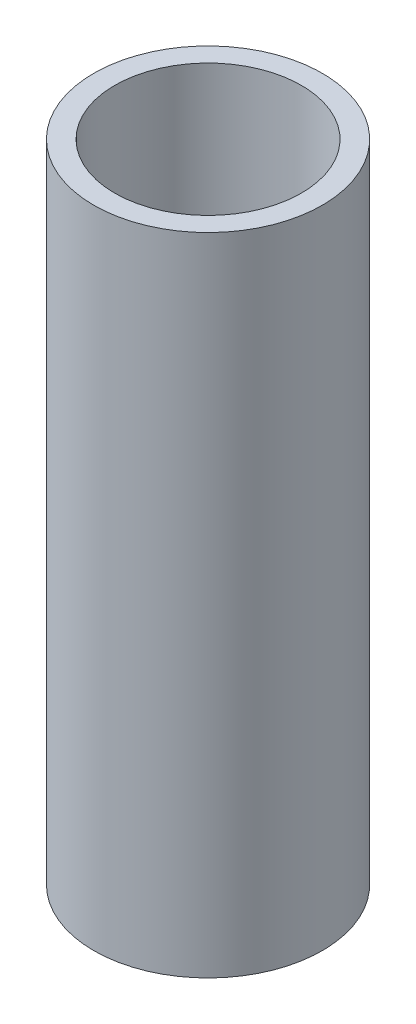
from build123d import *

# Parameters (mm, degrees)
SKETCH1_R           = 60
BOSS_EXTRUDE1_DEPTH = 338.922958864
SKETCH2_R           = 49.014750339
CUT_EXTRUDE1_DEPTH  = 350.383416958


with BuildPart() as part:
    # Sketch1 → Boss-Extrude1 (new body)
    with BuildSketch(Plane(origin=(0, 0, 0), x_dir=(1, 0, 0), z_dir=(0, 1, 0))):
        Circle(SKETCH1_R)
    extrude(amount=BOSS_EXTRUDE1_DEPTH)

    # Sketch2 → Cut-Extrude1 (cut, through all)
    with BuildSketch(Plane(origin=(0, 0, 0), x_dir=(1, 0, 0), z_dir=(0, 1, 0))):
        Circle(SKETCH2_R)
    extrude(amount=CUT_EXTRUDE1_DEPTH, mode=Mode.SUBTRACT)


solid = part.part
